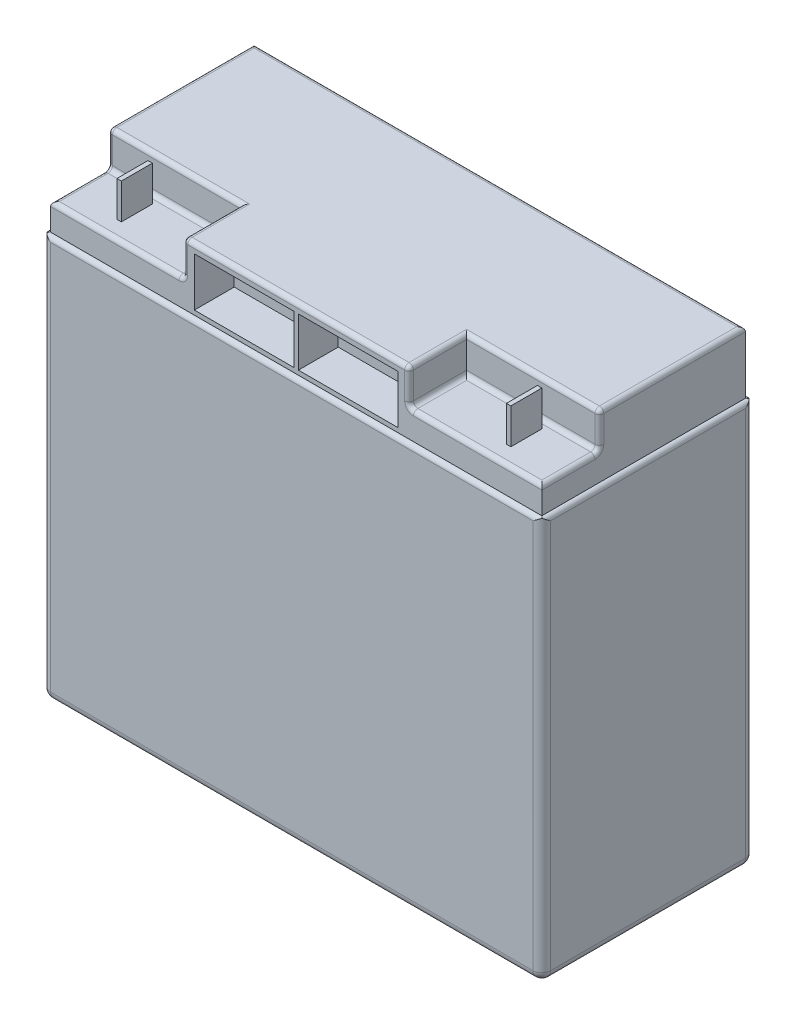
from build123d import *

# Parameters (mm, degrees)
SKETCH1_W          = 179.3875
SKETCH1_H          = 166.6875
EXTRUDE1_DEPTH     = 38.1
SKETCH2_W          = 179.3875
SKETCH2_H          = 76.2
SKETCH2_W_2        = 176.2125
SKETCH2_H_2        = 73.025
CUT_EXTRUDE1_DEPTH = 22.225
SKETCH3_W          = 47.625
SKETCH3_H          = 20.6375
CUT_EXTRUDE2_DEPTH = 12.7
SKETCH4_W          = 35.71875
SKETCH4_H          = 17.4625
CUT_EXTRUDE3_DEPTH = 14.2875
FILLET1_R          = 1.5748
FILLET2_R          = 3.175
SKETCH5_W          = 1.5875
SKETCH5_H          = 11.1125
EXTRUDE3_DEPTH     = 12.7


with BuildPart() as part:
    # Sketch1 → Extrude1 (new, symmetric)
    with BuildSketch(Plane.XY):
        Rectangle(SKETCH1_W, SKETCH1_H)
    extrude(amount=EXTRUDE1_DEPTH, both=True)

    # Sketch2 → Cut-Extrude1 (cut)
    with BuildSketch(Plane(origin=(0, 83.34375, 0), x_dir=(-1, 0, 0), z_dir=(0, 1, 0))):
        Rectangle(SKETCH2_W, SKETCH2_H)
        Rectangle(SKETCH2_W_2, SKETCH2_H_2, mode=Mode.SUBTRACT)
    extrude(amount=-CUT_EXTRUDE1_DEPTH, mode=Mode.SUBTRACT)

    # Sketch3 → Cut-Extrude2 (cut)
    with BuildSketch(Plane(origin=(0, 83.34375, 0), x_dir=(-1, 0, 0), z_dir=(0, 1, 0))):
        with Locations((-64.29375, 26.19375)):
            Rectangle(SKETCH3_W, SKETCH3_H)
        with Locations((64.29375, 26.19375)):
            Rectangle(SKETCH3_W, SKETCH3_H)
    extrude(amount=-CUT_EXTRUDE2_DEPTH, mode=Mode.SUBTRACT)

    # Sketch4 → Cut-Extrude3 (cut)
    with BuildSketch(Plane.XY.offset(36.5125)):
        with Locations((-18.653125, 71.4375)):
            Rectangle(SKETCH4_W, SKETCH4_H)
        with Locations((18.653125, 71.4375)):
            Rectangle(SKETCH4_W, SKETCH4_H)
    cut_extrude3 = extrude(amount=-CUT_EXTRUDE3_DEPTH, mode=Mode.SUBTRACT)

    # Mirror1: Cut-Extrude3 across plane
    add(cut_extrude3.mirror(Plane.XY), mode=Mode.SUBTRACT)

    # Fillet1
    fillet1_edges = [part.edges().sort_by_distance(p)[0] for p in [
        (89.69375, 61.11875, 0),
        (0, 61.11875, 38.1),
        (-89.69375, 61.11875, 0),
        (0, 61.11875, -38.1),
        (0, 83.34375, -36.5125),
        (-88.10625, 83.34375, -10.31875),
        (88.10625, 83.34375, -10.31875),
        (88.10625, 70.64375, 26.19375),
        (88.10625, 76.99375, 15.875),
        (64.29375, 70.64375, 36.5125),
        (40.48125, 70.64375, 26.19375),
        (40.48125, 76.99375, 36.5125),
        (64.29375, 70.64375, 15.875),
        (64.29375, 83.34375, 15.875),
        (40.48125, 83.34375, 26.19375),
        (0, 83.34375, 36.5125),
        (-88.10625, 70.64375, 26.19375),
        (-64.29375, 70.64375, 15.875),
        (-88.10625, 76.99375, 15.875),
        (-40.48125, 70.64375, 26.19375),
        (-64.29375, 70.64375, 36.5125),
        (-40.48125, 76.99375, 36.5125),
        (-40.48125, 83.34375, 26.19375),
        (-64.29375, 83.34375, 15.875),
    ]]
    fillet(fillet1_edges, radius=FILLET1_R)

    # Fillet2
    # the kernel refuses this fillet: 3.175 mm, written as the material it takes off along each edge
    with BuildSketch(Plane(origin=(-86.51875, -80.16875, -34.925), x_dir=(-1, 0, 0), z_dir=(0, 0, -1))) as fillet2_piece_1_section:
        Polygon((0, 0), (FILLET2_R * 1.02, 0), (FILLET2_R * 1.02, -FILLET2_R * 1.02), (0, -FILLET2_R * 1.02), align=None)
    fillet2_piece_1 = extrude(amount=FILLET2_R * 1.02, mode=Mode.PRIVATE)
    fillet2_piece_1 = fillet2_piece_1 - Plane(origin=(-86.51875, -80.16875, -34.925), x_dir=(0.7071067811865475, 0.7071067811865477, 0), z_dir=(0, 0, -1)) * Sphere(FILLET2_R, mode=Mode.PRIVATE)
    add(fillet2_piece_1, mode=Mode.SUBTRACT)
    with BuildSketch(Plane(origin=(-86.51875, -80.16875, 34.925), x_dir=(-1, 0, 0), z_dir=(0, 0, 1))) as fillet2_piece_2_section:
        Polygon((0, 0), (FILLET2_R * 1.02, 0), (FILLET2_R * 1.02, FILLET2_R * 1.02), (0, FILLET2_R * 1.02), align=None)
    fillet2_piece_2 = extrude(amount=FILLET2_R * 1.02, mode=Mode.PRIVATE)
    fillet2_piece_2 = fillet2_piece_2 - Plane(origin=(-86.51875, -80.16875, 34.925), x_dir=(0.7071067811865475, 0.7071067811865477, 0), z_dir=(0, 0, 1)) * Sphere(FILLET2_R, mode=Mode.PRIVATE)
    add(fillet2_piece_2, mode=Mode.SUBTRACT)
    with BuildSketch(Plane(origin=(86.51875, -80.16875, 34.925), x_dir=(0, 0, 1), z_dir=(1, 0, 0))) as fillet2_piece_3_section:
        Polygon((0, 0), (FILLET2_R * 1.02, 0), (FILLET2_R * 1.02, FILLET2_R * 1.02), (0, FILLET2_R * 1.02), align=None)
    fillet2_piece_3 = extrude(amount=FILLET2_R * 1.02, mode=Mode.PRIVATE)
    fillet2_piece_3 = fillet2_piece_3 - Plane(origin=(86.51875, -80.16875, 34.925), x_dir=(0, 0.7071067811865475, -0.7071067811865475), z_dir=(1, 0, 0)) * Sphere(FILLET2_R, mode=Mode.PRIVATE)
    add(fillet2_piece_3, mode=Mode.SUBTRACT)
    with BuildSketch(Plane(origin=(86.51875, -80.16875, -34.925), x_dir=(0, 0, -1), z_dir=(1, 0, 0))) as fillet2_piece_4_section:
        Polygon((0, 0), (FILLET2_R * 1.02, 0), (FILLET2_R * 1.02, -FILLET2_R * 1.02), (0, -FILLET2_R * 1.02), align=None)
    fillet2_piece_4 = extrude(amount=FILLET2_R * 1.02, mode=Mode.PRIVATE)
    fillet2_piece_4 = fillet2_piece_4 - Plane(origin=(86.51875, -80.16875, -34.925), x_dir=(0, 0.7071067811865475, 0.7071067811865475), z_dir=(1, 0, 0)) * Sphere(FILLET2_R, mode=Mode.PRIVATE)
    add(fillet2_piece_4, mode=Mode.SUBTRACT)
    with BuildSketch(Plane(origin=(-89.69375, -83.34375, -34.925), x_dir=(0, 1, 0), z_dir=(0, 0, 1)), Plane(origin=(89.69375, -83.34375, 34.925), x_dir=(0, 1, 0), z_dir=(0, 0, -1))) as fillet2_piece_5:
        with BuildLine():
            CenterArc((FILLET2_R, -FILLET2_R), FILLET2_R, 90, 90)
            Line((0, -FILLET2_R), (0, 0))
            Line((0, 0), (FILLET2_R, 0))
        make_face()
    extrude(amount=69.85, mode=Mode.SUBTRACT)
    with BuildSketch(Plane(origin=(86.51875, -83.34375, 38.1), x_dir=(0, 1, 0), z_dir=(-1, 0, 0))) as fillet2_piece_6:
        with BuildLine():
            CenterArc((FILLET2_R, FILLET2_R), FILLET2_R, 180, 90)
            Line((0, FILLET2_R), (0, 0))
            Line((0, 0), (FILLET2_R, 0))
        make_face()
    extrude(amount=173.0375, mode=Mode.SUBTRACT)
    with BuildSketch(Plane(origin=(86.51875, -83.34375, -38.1), x_dir=(0, 1, 0), z_dir=(-1, 0, 0))) as fillet2_piece_7:
        with BuildLine():
            CenterArc((FILLET2_R, -FILLET2_R), FILLET2_R, 90, 90)
            Line((0, -FILLET2_R), (0, 0))
            Line((0, 0), (FILLET2_R, 0))
        make_face()
    extrude(amount=173.0375, mode=Mode.SUBTRACT)
    with BuildSketch(Plane(origin=(-89.69375, -80.16875, 38.1), x_dir=(1, 0, 0), z_dir=(0, 1, 0)), Plane(origin=(89.69375, 67.48145, -38.1), x_dir=(0, 0, 1), z_dir=(0, -1, 0))) as fillet2_piece_8:
        with BuildLine():
            CenterArc((FILLET2_R, FILLET2_R), FILLET2_R, 180, 90)
            Line((0, FILLET2_R), (0, 0))
            Line((0, 0), (FILLET2_R, 0))
        make_face()
    extrude(amount=147.6502, mode=Mode.SUBTRACT)
    with BuildSketch(Plane(origin=(-89.69375, -80.16875, -38.1), x_dir=(1, 0, 0), z_dir=(0, 1, 0)), Plane(origin=(89.69375, 67.48145, 38.1), x_dir=(0, 0, -1), z_dir=(0, -1, 0))) as fillet2_piece_9:
        with BuildLine():
            CenterArc((FILLET2_R, -FILLET2_R), FILLET2_R, 90, 90)
            Line((0, -FILLET2_R), (0, 0))
            Line((0, 0), (FILLET2_R, 0))
        make_face()
    extrude(amount=147.6502, mode=Mode.SUBTRACT)

    # Sketch5 → Extrude3 (add)
    with BuildSketch(Plane(origin=(0, 70.64375, 0), x_dir=(-1, 0, 0), z_dir=(0, 1, 0))):
        with Locations((-69.85, 24.60625)):
            Rectangle(SKETCH5_W, SKETCH5_H)
        with Locations((69.85, 24.60625)):
            Rectangle(SKETCH5_W, SKETCH5_H)
    extrude(amount=EXTRUDE3_DEPTH)


solid = part.part
